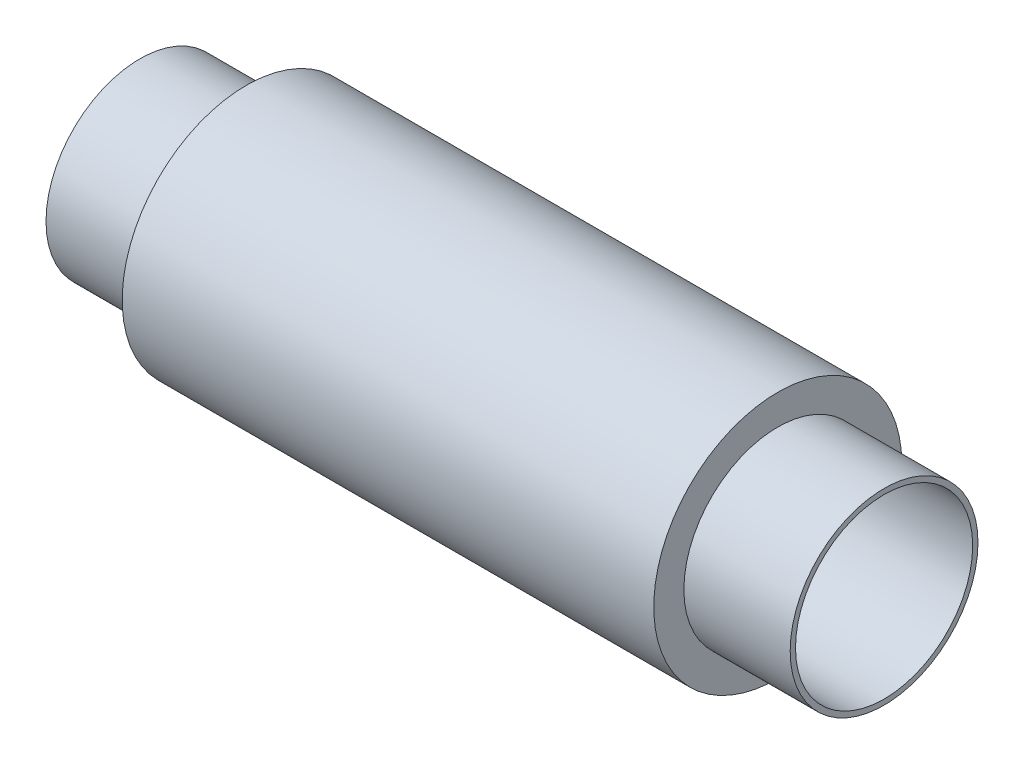
from build123d import *

# Parameters (mm, degrees)
SKETCH1_R           = 7
SKETCH1_R_2         = 5
BOSS_EXTRUDE1_DEPTH = 30
SKETCH2_W           = 6
SKETCH2_H           = 0.3


with BuildPart() as part:
    # Sketch1 → Boss-Extrude1 (new body)
    with BuildSketch(Plane(origin=(0, 0, 0), x_dir=(0, 0, -1), z_dir=(1, 0, 0))):
        Circle(SKETCH1_R)
        Circle(SKETCH1_R_2, mode=Mode.SUBTRACT)
    extrude(amount=BOSS_EXTRUDE1_DEPTH)

    # Sketch2 → Revolve1 (revolve)
    with BuildSketch(Plane.XY):
        with Locations((-3, 5.15)):
            Rectangle(SKETCH2_W, SKETCH2_H)
        with Locations((33, 5.15)):
            Rectangle(SKETCH2_W, SKETCH2_H)
    revolve(axis=Axis((-971, 0, 0), (1, 0, 0)))


solid = part.part
